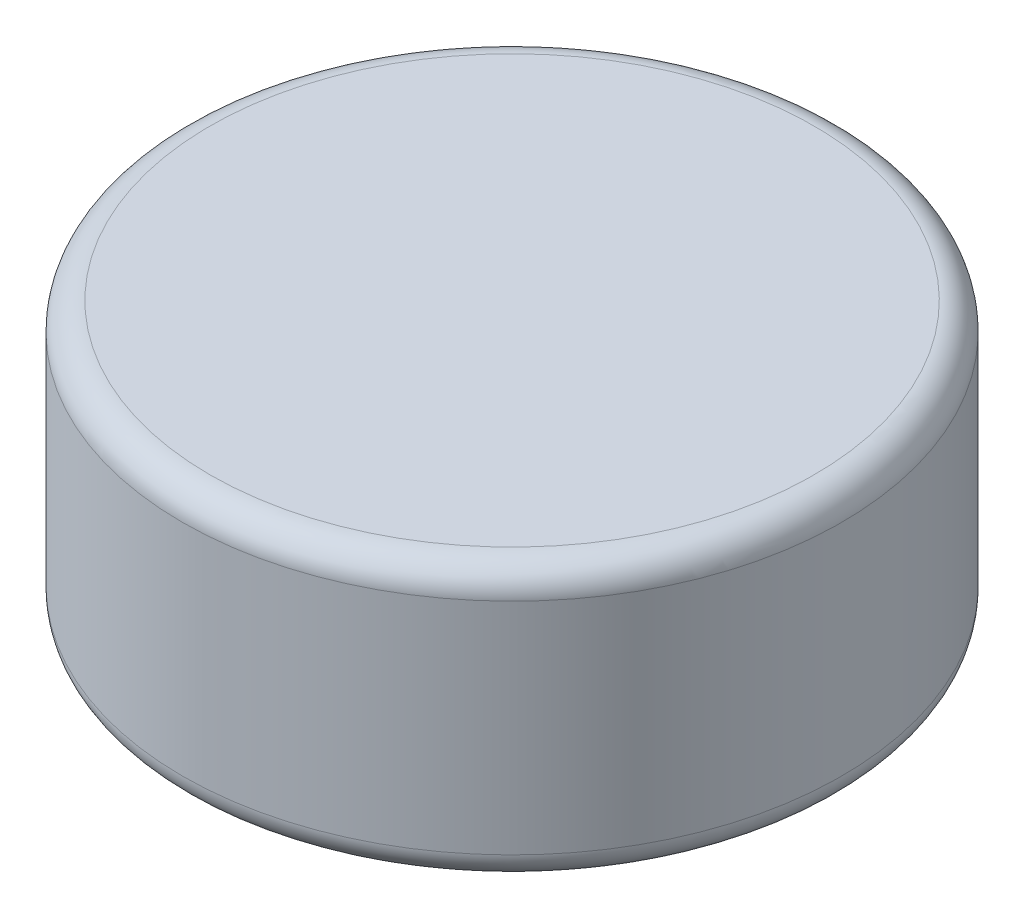
from build123d import *

# Parameters (mm, degrees)
SKETCH1_R           = 3
BOSS_EXTRUDE1_DEPTH = 1.25
FILLET1_R           = 0.25


with BuildPart() as part:
    # Sketch1 → Boss-Extrude1 (new, symmetric)
    with BuildSketch(Plane(origin=(0, 0, 0), x_dir=(1, 0, 0), z_dir=(0, 1, 0))):
        Circle(SKETCH1_R)
    extrude(amount=BOSS_EXTRUDE1_DEPTH, both=True)

    # Fillet1
    fillet1_edges = [part.edges().sort_by_distance(p)[0] for p in [
        (-3, -1.25, 0),
        (-3, 1.25, 0),
    ]]
    fillet(fillet1_edges, radius=FILLET1_R)


solid = part.part
